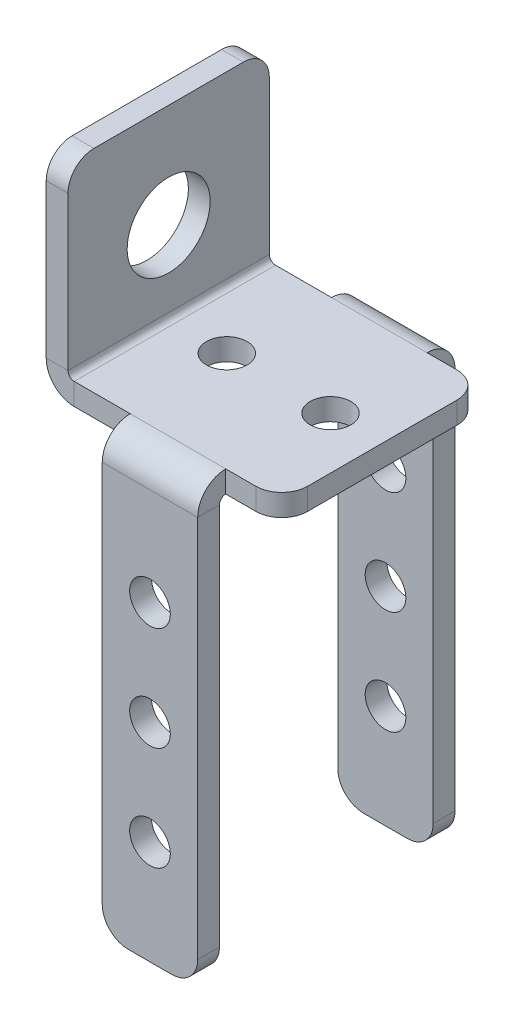
from build123d import *

# Parameters (mm, degrees)
BASE_FLANGE1_START       = -12.7
BASE_FLANGE1_DEPTH       = 25.4
EDGE_FLANGE1_DEPTH       = 24.638
SKETCH9_R                = 5.08
CUT_EXTRUDE1_DEPTH       = 86.568694538
CUT_EXTRUDE2_START       = -12.7
CUT_EXTRUDE2_DEPTH       = 6.858
CUT_EXTRUDE2_START_2     = 5.842
CUT_EXTRUDE2_2_DEPTH     = 6.858
CUT_EXTRUDE2_START_3     = -28.829
CUT_EXTRUDE2_3_OUTLINE_R = 2.4892
CUT_EXTRUDE2_3_DEPTH     = 31.496
CUT_EXTRUDE3_REACH       = 64.849
SKETCH11_R               = 2.4892
FILLET1_R                = 3.175


with BuildPart() as part:
    # Base-Flange1: read off the stored shape, not the designer's step
    # Base-Flange1 outline → Base-Flange1 (new body)
    with BuildSketch(Plane(origin=(0, 0, 0), x_dir=(0, 0, -1), z_dir=(1, 0, 0)).offset(BASE_FLANGE1_START)):
        with BuildLine():
            Line((26.162, 50.038), (26.162, 0))
            Line((26.162, 0), (28.829, 0))
            Line((28.829, 0), (28.829, 50.038))
            ThreePointArc((28.829, 50.038), (27.824669153, 52.462669153), (25.4, 53.467))
            Line((25.4, 53.467), (0.762, 53.467))
            ThreePointArc((0.762, 53.467), (-1.662669153, 52.462669153), (-2.667, 50.038))
            Line((-2.667, 50.038), (-2.667, 0))
            Line((-2.667, 0), (0, 0))
            Line((0, 0), (0, 50.038))
            ThreePointArc((0, 50.038), (0.223184633, 50.576815367), (0.762, 50.8))
            Line((0.762, 50.8), (25.4, 50.8))
            ThreePointArc((25.4, 50.8), (25.938815367, 50.576815367), (26.162, 50.038))
        make_face()
    extrude(amount=BASE_FLANGE1_DEPTH)

    # Edge-Flange1: sheet metal written as solids
    # Edge-Flange1 section (on a plane across the edge) → Edge-Flange1 (add)
    with BuildSketch(Plane(origin=(-13.462, 53.467, -25.4), x_dir=(1, 0, 0), z_dir=(0, 0, 1))):
        with BuildLine():
            Line((-2.667, 0.762), (-2.667, 22.733))
            Line((-2.667, 22.733), (0, 22.733))
            Line((0, 22.733), (0, 0.762))
            ThreePointArc((0, 0.762), (0.223184633, 0.223184633), (0.762, 0))
            Line((0.762, 0), (0.762, -2.667))
            ThreePointArc((0.762, -2.667), (-1.662669153, -1.662669153), (-2.667, 0.762))
        make_face()
    extrude(amount=EDGE_FLANGE1_DEPTH)

    # Sketch9 → Cut-Extrude1 (cut, through all)
    with BuildSketch(Plane(origin=(-13.462, 0, 0), x_dir=(0, 0, -1), z_dir=(1, 0, 0))):
        with Locations(Location((13.081, 63.5, 0), (0, 0, 90))):
            Circle(SKETCH9_R)
    extrude(amount=-CUT_EXTRUDE1_DEPTH, mode=Mode.SUBTRACT)

    # Cut-Extrude2: read off the stored shape, not the designer's step
    # Cut-Extrude2 outline → Cut-Extrude2 (cut)
    with BuildSketch(Plane.YZ.offset(CUT_EXTRUDE2_START)):
        with BuildLine():
            Line((53.467, -25.4), (50.8, -25.4))
            ThreePointArc((50.8, -25.4), (50.576815367, -25.938815367), (50.038, -26.162))
            Line((50.038, -26.162), (0, -26.162))
            Line((0, -26.162), (0, -28.829))
            Line((0, -28.829), (50.038, -28.829))
            ThreePointArc((50.038, -28.829), (52.462669153, -27.824669153), (53.467, -25.4))
        make_face()
        with BuildLine():
            ThreePointArc((50.038, 0), (50.576815367, -0.223184633), (50.8, -0.762))
            Line((50.8, -0.762), (53.467, -0.762))
            ThreePointArc((53.467, -0.762), (52.462669153, 1.662669153), (50.038, 2.667))
            Line((50.038, 2.667), (0, 2.667))
            Line((0, 2.667), (0, 0))
            Line((0, 0), (50.038, 0))
        make_face()
    extrude(amount=CUT_EXTRUDE2_DEPTH, mode=Mode.SUBTRACT)

    # Cut-Extrude2 2 outline → Cut-Extrude2 2 (cut)
    with BuildSketch(Plane.YZ.offset(CUT_EXTRUDE2_START_2)):
        with BuildLine():
            Line((53.467, -25.4), (50.8, -25.4))
            ThreePointArc((50.8, -25.4), (50.576815367, -25.938815367), (50.038, -26.162))
            Line((50.038, -26.162), (0, -26.162))
            Line((0, -26.162), (0, -28.829))
            Line((0, -28.829), (50.038, -28.829))
            ThreePointArc((50.038, -28.829), (52.462669153, -27.824669153), (53.467, -25.4))
        make_face()
        with BuildLine():
            ThreePointArc((50.038, 0), (50.576815367, -0.223184633), (50.8, -0.762))
            Line((50.8, -0.762), (53.467, -0.762))
            ThreePointArc((53.467, -0.762), (52.462669153, 1.662669153), (50.038, 2.667))
            Line((50.038, 2.667), (0, 2.667))
            Line((0, 2.667), (0, 0))
            Line((0, 0), (50.038, 0))
        make_face()
    extrude(amount=CUT_EXTRUDE2_2_DEPTH, mode=Mode.SUBTRACT)

    # Cut-Extrude2 3 outline → Cut-Extrude2 3 (cut)
    with BuildSketch(Plane.XY.offset(CUT_EXTRUDE2_START_3)):
        with Locations((0, 12.7)):
            Circle(CUT_EXTRUDE2_3_OUTLINE_R)
        with Locations((0, 38.1)):
            Circle(CUT_EXTRUDE2_3_OUTLINE_R)
        with Locations((0, 25.4)):
            Circle(CUT_EXTRUDE2_3_OUTLINE_R)
    extrude(amount=CUT_EXTRUDE2_3_DEPTH, mode=Mode.SUBTRACT)

    # Sketch11 → Cut-Extrude3 (cut, up to next)
    with BuildSketch(Plane(origin=(0, 53.467, 0), x_dir=(1, 0, 0), z_dir=(0, 1, 0)), mode=Mode.PRIVATE) as cut_extrude3_sk1:
        with Locations(Location((-6.35, 13.081, 0), (0, 0, 270))):
            Circle(SKETCH11_R)
    cut_extrude3_tool1 = extrude(cut_extrude3_sk1.sketch, amount=-CUT_EXTRUDE3_REACH, mode=Mode.PRIVATE) & part.part
    # Sketch11 → Cut-Extrude3 (cut, up to next)
    with BuildSketch(Plane(origin=(0, 53.467, 0), x_dir=(1, 0, 0), z_dir=(0, 1, 0)), mode=Mode.PRIVATE) as cut_extrude3_sk2:
        with Locations(Location((6.35, 13.081, 0), (0, 0, 270))):
            Circle(SKETCH11_R)
    cut_extrude3_tool2 = extrude(cut_extrude3_sk2.sketch, amount=-CUT_EXTRUDE3_REACH, mode=Mode.PRIVATE) & part.part
    add(cut_extrude3_tool1.solids().sort_by_distance((-6.35, 53.467, -13.081))[0], mode=Mode.SUBTRACT)
    add(cut_extrude3_tool2.solids().sort_by_distance((6.35, 53.467, -13.081))[0], mode=Mode.SUBTRACT)

    # Fillet1
    fillet1_edges = [part.edges().sort_by_distance(p)[0] for p in [
        (5.842, 0, 1.3335),
        (-5.842, 0, 1.3335),
        (5.842, 0, -27.4955),
        (-5.842, 0, -27.4955),
        (12.7, 52.1335, -25.4),
        (12.7, 52.1335, -0.762),
        (-14.7955, 76.2, -25.4),
        (-14.7955, 76.2, -0.762),
    ]]
    fillet(fillet1_edges, radius=FILLET1_R)


solid = part.part
